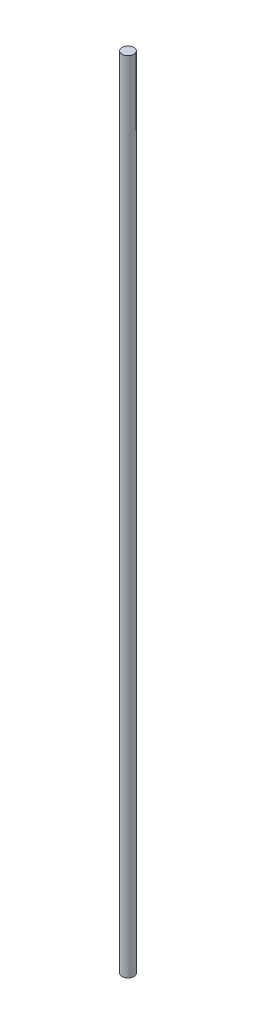
from build123d import *

# Parameters (mm, degrees)
SKETCH_2_W = 2.5
SKETCH_2_H = 335.9


with BuildPart() as part:
    # Эскиз2 → Повернуть1 (revolve)
    with BuildSketch(Plane.XY):
        with Locations((-1.25, 0)):
            Rectangle(SKETCH_2_W, SKETCH_2_H)
    revolve(axis=Axis((-2.5, 167.95, 0), (0, -1, 0)))


solid = part.part
